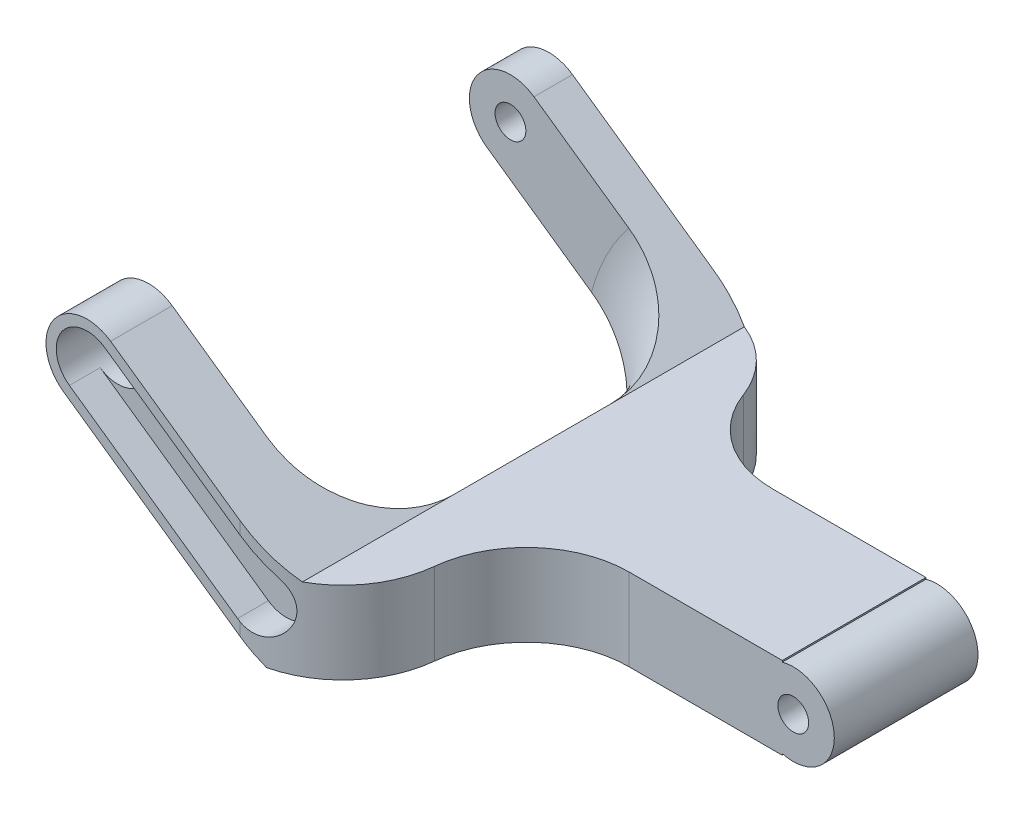
from build123d import *

# Parameters (mm, degrees)
SKETCH_1_R           = 1.5
EXTRUDE_2_DEPTH      = 50
SKETCH_14_W          = 30
SKETCH_14_H          = 18
CUT_EXTRUDE_6_DEPTH  = 65.195102675
SKETCH_15_W          = 22.4475894
SKETCH_15_H          = 16.25
CUT_EXTRUDE_7_DEPTH  = 30
SKETCH_17_W          = 25.359818697
SKETCH_17_H          = 19
CUT_EXTRUDE_9_DEPTH  = 30
FILLET_8_R           = 10
SKETCH_19_W          = 34.027540403
SKETCH_19_H          = 5
CUT_EXTRUDE_11_DEPTH = 65.759348106
FILLET_9_R           = 10
FILLET_11_R          = 10
FILLET_12_R          = 10
CUT_EXTRUDE_12_DEPTH = 3
CUT_EXTRUDE_START    = -5
SKETCH_21_R          = 3
CUT_EXTRUDE_13_DEPTH = 5


with BuildPart() as part:
    # 草图1 → 凸台-拉伸2 (new body)
    with BuildSketch(Plane.XY):
        with BuildLine():
            Line((15.60515688, 4.016530447), (15.60515688, 4.161375168))
            Line((15.60515688, 4.161375168), (-16.917233431, 4.161375168))
            Line((-16.917233431, 4.161375168), (-36.422020871, -9.496024029))
            ThreePointArc((-36.422020871, -9.496024029), (-37.404323302, -15.066937951), (-31.83340938, -16.049240383))
            Line((-31.83340938, -16.049240383), (-14.39484312, -3.838624832))
            Line((-14.39484312, -3.838624832), (15.60515688, -3.838624832))
            Line((15.60515688, -3.838624832), (15.60515688, -3.693780111))
            ThreePointArc((15.60515688, -3.693780111), (20.671823547, 0.161375168), (15.60515688, 4.016530447))
        make_face()
        with Locations((-34.127715125, -12.772632206)):
            Circle(SKETCH_1_R, mode=Mode.SUBTRACT)
        with Locations((16.671823547, 0.161375168)):
            Circle(SKETCH_1_R, mode=Mode.SUBTRACT)
    extrude(amount=EXTRUDE_2_DEPTH)

    # 草图14 → 切除-拉伸6 (cut, through all)
    with BuildSketch(Plane.XZ.offset(3.838624832)):
        with Locations((5.671823547, 41)):
            Rectangle(SKETCH_14_W, SKETCH_14_H)
        with Locations((5.671823547, 9)):
            Rectangle(SKETCH_14_W, SKETCH_14_H)
    extrude(amount=-CUT_EXTRUDE_6_DEPTH, mode=Mode.SUBTRACT)

    # 草图15 → 切除-拉伸7 (cut)
    with BuildSketch(Plane(origin=(0, 4.161375168, 0), x_dir=(1, 0, 0), z_dir=(0, 1, 0))):
        with Locations((-28.141028131, -16.875)):
            Rectangle(SKETCH_15_W, SKETCH_15_H)
    extrude(amount=-CUT_EXTRUDE_7_DEPTH, mode=Mode.SUBTRACT)

    # 草图17 → 切除-拉伸9 (cut)
    with BuildSketch(Plane(origin=(0, 4.161375168, 0), x_dir=(1, 0, 0), z_dir=(0, 1, 0))):
        with Locations((-29.59714278, -34.5)):
            Rectangle(SKETCH_17_W, SKETCH_17_H)
    extrude(amount=-CUT_EXTRUDE_9_DEPTH, mode=Mode.SUBTRACT)

    # 圆角8
    # the kernel refuses this fillet: 10 mm, written as the material it takes off along each edge
    with BuildSketch(Plane(origin=(-16.917233431, -5.604821542, 8.75), x_dir=(0.8191520442889905, 0.573576436351048, 0), z_dir=(0, 0, 1))) as fillet_8_piece_1:
        with BuildLine():
            CenterArc((13.012933373, 1.149926903), FILLET_8_R, 145, 41.603203435)
            Line((4.82141293, 6.885691266), (0, 0))
            Line((0, 0), (3.079269995, 0))
        make_face()
    extrude(amount=35.25, mode=Mode.SUBTRACT)

    # 草图19 → 切除-拉伸11 (cut, through all)
    with BuildSketch(Plane(origin=(-7.520806183, 10.740824359, 0), x_dir=(0.8191520442889908, 0.5735764363510477, 0), z_dir=(-0.5735764363510477, 0.8191520442889908, 0))):
        with Locations((-22.268098274, -2.5)):
            Rectangle(SKETCH_19_W, SKETCH_19_H)
    extrude(amount=-CUT_EXTRUDE_11_DEPTH, mode=Mode.SUBTRACT)

    # 圆角9
    fillet_9_edges = [part.edges().sort_by_distance(p)[0] for p in [
        (-9.328176453, 0.161375168, 18),
        (-9.328176453, 0.161375168, 32),
    ]]
    fillet(fillet_9_edges, radius=FILLET_9_R)

    # 圆角11
    # the kernel refuses this fillet: 10 mm, written as the material it adds along each edge
    with BuildSketch(Plane(origin=(-16.917233431, 29.161375168, 44), x_dir=(0, 0, -1), z_dir=(0, -1, 0))) as fillet_11_piece_1_section:
        with BuildLine():
            CenterArc((FILLET_11_R, -FILLET_11_R), FILLET_11_R, 90, 90)
            Line((0, -FILLET_11_R), (0, 0))
            Line((0, 0), (FILLET_11_R, 0))
        make_face()
    fillet_11_piece_1 = extrude(amount=26.360319786, mode=Mode.PRIVATE)
    fillet_11_piece_1 = split(fillet_11_piece_1, bisect_by=Plane(origin=(-17.705446038, 3.609462759, 40.498761656), z_dir=(0.5735764363510475, -0.8191520442889908, 0)), keep=Keep.TOP, mode=Mode.PRIVATE)
    add(fillet_11_piece_1)
    with BuildSketch(Plane(origin=(-16.917233431, 29.161375168, 8.75), x_dir=(-1, 0, 0), z_dir=(0, -1, 0))) as fillet_11_piece_2_section:
        with BuildLine():
            CenterArc((FILLET_11_R, -FILLET_11_R), FILLET_11_R, 90, 90)
            Line((0, -FILLET_11_R), (0, 0))
            Line((0, 0), (FILLET_11_R, 0))
        make_face()
    fillet_11_piece_2 = extrude(amount=26.360319786, mode=Mode.PRIVATE)
    fillet_11_piece_2 = split(fillet_11_piece_2, bisect_by=Plane(origin=(-17.705446038, 3.609462759, 12.251238344), z_dir=(0.5735764363510475, -0.8191520442889908, 0)), keep=Keep.TOP, mode=Mode.PRIVATE)
    add(fillet_11_piece_2)
    with BuildSketch(Plane(origin=(-6.917233431, 2.801055382, 8.75), x_dir=(-1, 0, 0), z_dir=(0, 1, 0))) as fillet_11_piece_3_section:
        with BuildLine():
            CenterArc((10 + FILLET_11_R, FILLET_11_R), FILLET_11_R, 180, 90)
            Line((10 + FILLET_11_R, 0), (10, 0))
            Line((10, 0), (10, FILLET_11_R))
        make_face()
    fillet_11_piece_3 = revolve(axis=Axis((-6.917233431, 2.801055382, 8.75), (0, 0, 1)), revolution_arc=184.854944875, mode=Mode.PRIVATE)
    fillet_11_piece_3 = split(fillet_11_piece_3, bisect_by=Plane(origin=(-14.201650521, -3.703349918, 18.374598869), z_dir=(-0.5735764363510472, 0.819152044288991, 0)), keep=Keep.TOP, mode=Mode.PRIVATE)
    fillet_11_piece_3 = split(fillet_11_piece_3, bisect_by=Plane(origin=(-18.790262012, 2.849866436, 18.374598869), z_dir=(0.5735764363510475, -0.8191520442889908, 0)), keep=Keep.TOP, mode=Mode.PRIVATE)
    add(fillet_11_piece_3)
    with BuildSketch(Plane(origin=(-6.917233431, 2.801055382, 44), x_dir=(-1, 0, 0), z_dir=(0, 1, 0))) as fillet_11_piece_4_section:
        with BuildLine():
            CenterArc((10 + FILLET_11_R, -FILLET_11_R), FILLET_11_R, 90, 90)
            Line((10 + FILLET_11_R, 0), (10, 0))
            Line((10, 0), (10, -FILLET_11_R))
        make_face()
    fillet_11_piece_4 = revolve(axis=Axis((-6.917233431, 2.801055382, 44), (0, 0, 1)), revolution_arc=184.854944875, mode=Mode.PRIVATE)
    fillet_11_piece_4 = split(fillet_11_piece_4, bisect_by=Plane(origin=(-14.743190126, -4.082540032, 40.444195091), z_dir=(-0.5735764363510472, 0.819152044288991, 0)), keep=Keep.TOP, mode=Mode.PRIVATE)
    fillet_11_piece_4 = split(fillet_11_piece_4, bisect_by=Plane(origin=(-19.331801617, 2.470676322, 40.444195091), z_dir=(0.5735764363510475, -0.8191520442889908, 0)), keep=Keep.TOP, mode=Mode.PRIVATE)
    add(fillet_11_piece_4)

    # 圆角12
    # the kernel refuses this fillet: 10 mm, written as the material it takes off along each edge
    with BuildSketch(Plane(origin=(-9.328176453, -28.587996687, 50), x_dir=(-1, 0, 0), z_dir=(0, 1, 0))) as fillet_12_piece_1:
        with BuildLine():
            CenterArc((9.899748742, -10), FILLET_12_R, 90, 84.260829523)
            Line((-0.050125629, -9), (-1.045113066, -8.9))
            ThreePointArc((-1.045113066, -8.9), (-1, -8), (-1, 0))
            Line((-1, 0), (0, 1))
            Line((0, 1), (9.899748742, 1))
            Line((9.899748742, 1), (9.899748742, 0))
        make_face()
    extrude(amount=57.498743711, mode=Mode.SUBTRACT)
    with BuildSketch(Plane(origin=(-9.328176453, -25.67610982, 5), x_dir=(-1, 0, 0), z_dir=(0, 1, 0))) as fillet_12_piece_2:
        with BuildLine():
            CenterArc((8.734993995, 10), FILLET_12_R, 200.487315115, 69.512684885)
            Line((-0.632503002, 6.5), (-1.569252702, 6.15))
            ThreePointArc((-1.569252702, 6.15), (-1, 3), (-1, 0))
            Line((-1, 0), (0, -1))
            Line((0, -1), (8.734993995, -1))
            Line((8.734993995, -1), (8.734993995, 0))
        make_face()
    extrude(amount=51.674969976, mode=Mode.SUBTRACT)

    # 草图20 → 切除-拉伸12 (cut)
    with BuildSketch(Plane.XY.offset(50)):
        with BuildLine():
            Line((-35.848444434, -10.315176073), (-19.465403549, 1.156352654))
            ThreePointArc((-19.465403549, 1.156352654), (-15.287218107, 0.41962583), (-16.02394493, -3.758559612))
            Line((-16.02394493, -3.758559612), (-32.406985816, -15.230088339))
            ThreePointArc((-32.406985816, -15.230088339), (-36.585171258, -14.493361515), (-35.848444434, -10.315176073))
        make_face()
    extrude(amount=-CUT_EXTRUDE_12_DEPTH, mode=Mode.SUBTRACT)

    # 草图21 → 切除-拉伸13 (cut)
    with BuildSketch(Plane(origin=(0, 0, 44), x_dir=(-1, 0, 0), z_dir=(0, 0, -1)).offset(CUT_EXTRUDE_START)):
        with Locations(Location((34.127715125, -12.772632206, 0), (0, 0, 235))):
            Circle(SKETCH_21_R)
    extrude(amount=CUT_EXTRUDE_13_DEPTH, mode=Mode.SUBTRACT)


with BuildPart() as body_2:
    # 镜向1: mirrored copy
    add(part.part.mirror(Plane.ZX.offset(14.161375168)))


solid = body_2.part
